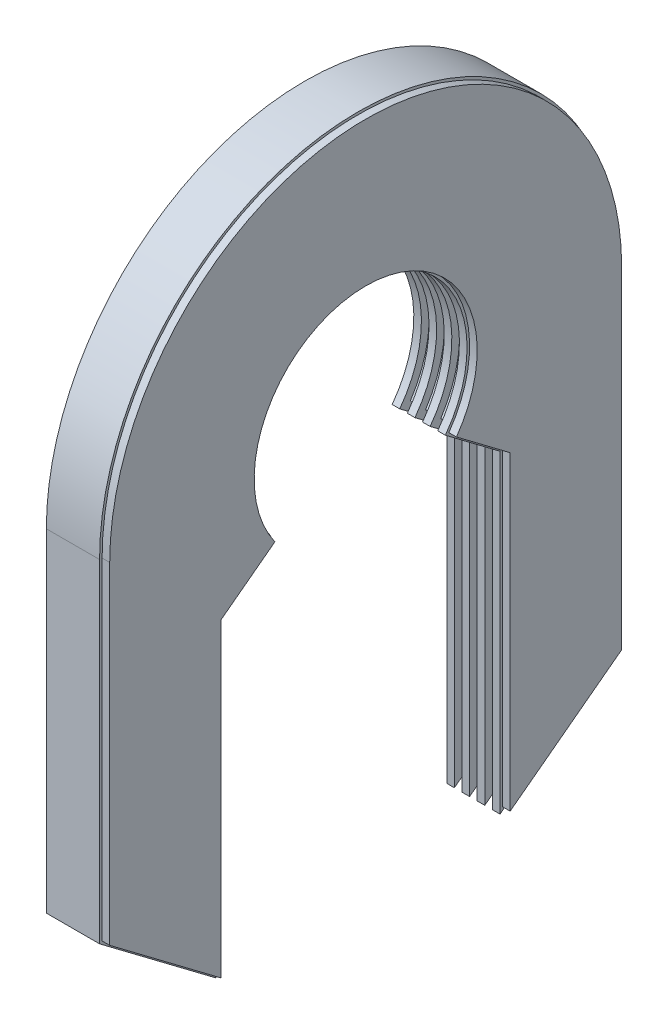
from build123d import *

# Parameters (mm, degrees)
EXTRUDE_1_DEPTH     = 21
EXTRUDE_2_DEPTH     = 3
SKETCH_4_W          = 27
SKETCH_4_H          = 125.4
CUT_EXTRUDE_1_DEPTH = 16.5
CUT_EXTRUDE_3_DEPTH = 32
SKETCH_6_W          = 32
SKETCH_6_H          = 32
CUT_EXTRUDE_4_DEPTH = 16.5
FILLET_1_R          = 3
SWEEP_START         = 3
SWEEP_3_DEPTH       = 3
SWEEP_START_2       = 9
SWEEP_3_2_DEPTH     = 3
SWEEP_START_3       = 15
SWEEP_3_3_DEPTH     = 3


# Read off the part's stored shape, not the designer's step: Вырез-По траектории3
with BuildPart() as part:
    # Эскиз1 → Бобышка-Вытянуть1 (new body)
    with BuildSketch(Plane(origin=(0, 0, 0), x_dir=(0, 0, -1), z_dir=(1, 0, 0))):
        with BuildLine():
            Line((-56, -42), (-34.436750731, -25.75092618))
            ThreePointArc((-34.436750731, -25.75092618), (0, 43), (34.436750731, -25.75092618))
            Line((34.436750731, -25.75092618), (56, -42))
            Line((56, -42), (56, -166))
            Line((56, -166), (102, -131.336513695))
            Line((102, -131.336513695), (102, 0))
            ThreePointArc((102, 0), (0, 102), (-102, 0))
            Line((-102, 0), (-102, -131.336513695))
            Line((-102, -131.336513695), (-56, -166))
            Line((-56, -166), (-56, -42))
        make_face()
    extrude(amount=EXTRUDE_1_DEPTH)

    # Эскиз3 → Бобышка-Вытянуть2 (add)
    with BuildSketch(Plane(origin=(21, 0, 0), x_dir=(0, 0, -1), z_dir=(1, 0, 0))):
        with BuildLine():
            Line((-57, -41.501418392), (-35.82524401, -25.545095256))
            ThreePointArc((-35.82524401, -25.545095256), (0, 44), (35.82524401, -25.545095256))
            Line((35.82524401, -25.545095256), (57, -41.501418392))
            Line((57, -41.501418392), (57, -164))
            Line((57, -164), (101, -130.843621795))
            Line((101, -130.843621795), (101, 0))
            ThreePointArc((101, 0), (0, 101), (-101, 0))
            Line((-101, 0), (-101, -130.843621795))
            Line((-101, -130.843621795), (-57, -164))
            Line((-57, -164), (-57, -41.501418392))
        make_face()
    extrude(amount=EXTRUDE_2_DEPTH)

    # Эскиз4 → Вырез-Вытянуть1 (cut)
    with BuildSketch(Plane.ZY):
        with Locations((-79.5, -62.7)):
            Rectangle(SKETCH_4_W, SKETCH_4_H)
    extrude(amount=-CUT_EXTRUDE_1_DEPTH, mode=Mode.SUBTRACT)

    # Sketch 1 2 → Вырез-Вытянуть3 (cut)
    with BuildSketch(Plane(origin=(0, 0, 95.5), x_dir=(0.400818834019707, -0.9161573349021895, 0), z_dir=(0, 0, 1))):
        Polygon((0, 0), (29.317034717, -12.826202689), (34.928498393, 0), (6.613510761, 15.116596026), align=None)
    extrude(amount=-CUT_EXTRUDE_3_DEPTH, mode=Mode.SUBTRACT)

    # Эскиз6 → Вырез-Вытянуть4 (cut)
    with BuildSketch(Plane.ZY):
        with Locations((79.5, -63)):
            Rectangle(SKETCH_6_W, SKETCH_6_H)
    extrude(amount=-CUT_EXTRUDE_4_DEPTH, mode=Mode.SUBTRACT)

    # Скругление1
    fillet_1_edges = [part.edges().sort_by_distance(p)[0] for p in [
        (8.25, -125.4, -66),
        (8.25, -125.4, -93),
        (8.25, 0, -66),
        (8.25, 0, -93),
        (8.25, -79, 95.5),
        (8.25, -79, 63.5),
        (8.25, -47, 95.5),
        (8.25, -47, 63.5),
        (7, -32, 63.5),
        (7, -32, 95.5),
        (8.25, 0, 63.5),
        (8.25, 0, 95.5),
    ]]
    fillet(fillet_1_edges, radius=FILLET_1_R)

    # Вырез-По траектории3 outline → Вырез-По траектории3 (cut)
    with BuildSketch(Plane.YZ.offset(SWEEP_START)):
        with BuildLine():
            Line((-25.153803165, 38.62926215), (-40.504255176, 59))
            Line((-40.504255176, 59), (-163.73933785, 59))
            Line((-163.73933785, 59), (-166, 56))
            Line((-166, 56), (-42, 56))
            Line((-42, 56), (-25.75092618, 34.436750731))
            ThreePointArc((-25.75092618, 34.436750731), (43, 0), (-25.75092618, -34.436750731))
            Line((-25.75092618, -34.436750731), (-42, -56))
            Line((-42, -56), (-166, -56))
            Line((-166, -56), (-163.73933785, -59))
            Line((-163.73933785, -59), (-40.504255176, -59))
            Line((-40.504255176, -59), (-25.153803165, -38.62926215))
            ThreePointArc((-25.153803165, -38.62926215), (46.097003242, 0), (-25.153803165, 38.62926215))
        make_face()
    extrude(amount=SWEEP_3_DEPTH, mode=Mode.SUBTRACT)

    # Sweep 3 2 outline → Sweep 3 2 (cut)
    with BuildSketch(Plane.YZ.offset(SWEEP_START_2)):
        with BuildLine():
            Line((-25.153803165, 38.62926215), (-40.504255176, 59))
            Line((-40.504255176, 59), (-163.73933785, 59))
            Line((-163.73933785, 59), (-166, 56))
            Line((-166, 56), (-42, 56))
            Line((-42, 56), (-25.75092618, 34.436750731))
            ThreePointArc((-25.75092618, 34.436750731), (43, 0), (-25.75092618, -34.436750731))
            Line((-25.75092618, -34.436750731), (-42, -56))
            Line((-42, -56), (-166, -56))
            Line((-166, -56), (-163.73933785, -59))
            Line((-163.73933785, -59), (-40.504255176, -59))
            Line((-40.504255176, -59), (-25.153803165, -38.62926215))
            ThreePointArc((-25.153803165, -38.62926215), (46.097003242, 0), (-25.153803165, 38.62926215))
        make_face()
    extrude(amount=SWEEP_3_2_DEPTH, mode=Mode.SUBTRACT)

    # Sweep 3 3 outline → Sweep 3 3 (cut)
    with BuildSketch(Plane.YZ.offset(SWEEP_START_3)):
        with BuildLine():
            Line((-25.153803165, 38.62926215), (-40.504255176, 59))
            Line((-40.504255176, 59), (-163.73933785, 59))
            Line((-163.73933785, 59), (-166, 56))
            Line((-166, 56), (-42, 56))
            Line((-42, 56), (-25.75092618, 34.436750731))
            ThreePointArc((-25.75092618, 34.436750731), (43, 0), (-25.75092618, -34.436750731))
            Line((-25.75092618, -34.436750731), (-42, -56))
            Line((-42, -56), (-166, -56))
            Line((-166, -56), (-163.73933785, -59))
            Line((-163.73933785, -59), (-40.504255176, -59))
            Line((-40.504255176, -59), (-25.153803165, -38.62926215))
            ThreePointArc((-25.153803165, -38.62926215), (46.097003242, 0), (-25.153803165, 38.62926215))
        make_face()
    extrude(amount=SWEEP_3_3_DEPTH, mode=Mode.SUBTRACT)


solid = part.part
